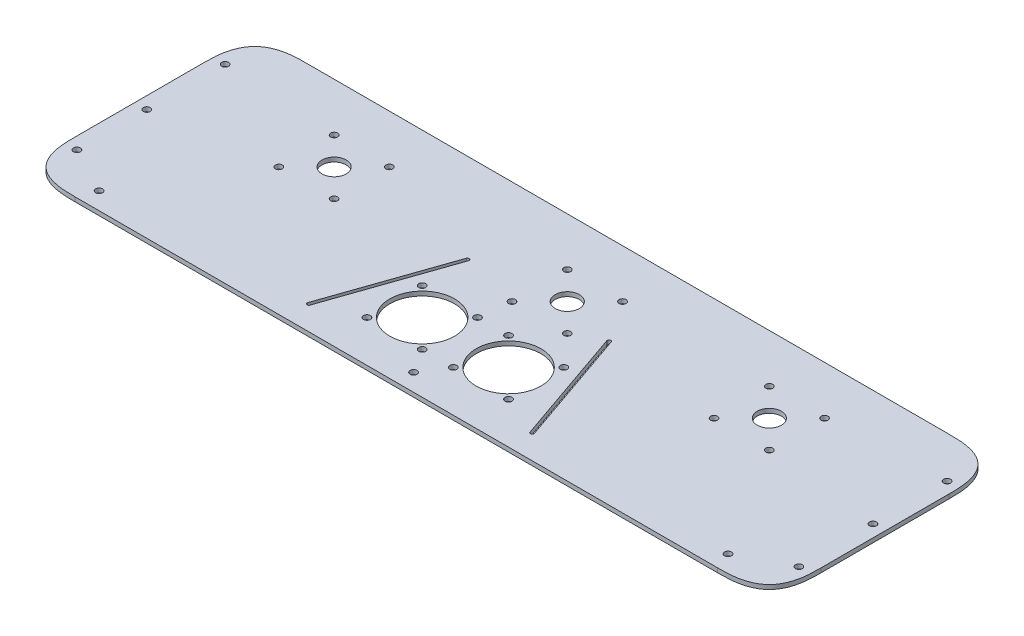
from build123d import *

# Parameters (mm, degrees)
SKETCH1_W           = 432
SKETCH1_H           = 200
BOSS_EXTRUDE1_DEPTH = 2.5
SKETCH3_R           = 7
SKETCH3_R_2         = 2
SKETCH3_W           = 498.20945101
SKETCH3_H           = 57.36356312
CUT_EXTRUDE1_DEPTH  = 2.5
SKETCH5_W           = 366.875294571
SKETCH5_H           = 10
SKETCH5_W_2         = 65.124705429
CUT_EXTRUDE3_DEPTH  = 2.5
SKETCH6_R           = 2
CUT_EXTRUDE4_DEPTH  = 2.5
CUT_EXTRUDE5_DEPTH  = 2.5
FILLET1_SIZE        = 30
SKETCH9_R           = 2
CUT_EXTRUDE6_DEPTH  = 2.5
SKETCH10_R          = 2
CUT_EXTRUDE7_DEPTH  = 2.5
SKETCH6_3_R         = 18.75
CUT_EXTRUDE8_DEPTH  = 10
SKETCH12_R          = 7
SKETCH12_R_2        = 2
CUT_EXTRUDE9_DEPTH  = 10


with BuildPart() as part:
    # Sketch1 → Boss-Extrude1 (new body)
    with BuildSketch(Plane(origin=(0, 0, 0), x_dir=(1, 0, 0), z_dir=(0, 1, 0))):
        with Locations((112.865968756, 71.914913526)):
            Rectangle(SKETCH1_W, SKETCH1_H)
    extrude(amount=BOSS_EXTRUDE1_DEPTH)

    # Sketch3 → Cut-Extrude1 (cut)
    with BuildSketch(Plane(origin=(0, 2.5, 0), x_dir=(1, 0, 0), z_dir=(0, 1, 0))):
        with Locations(Location((-13.134031244, 71.914913526, 0), (0, 0, 270))):
            Circle(SKETCH3_R)
        with Locations(Location((-29.135857702, 55.913087067, 0), (0, 0, 270))):
            Circle(SKETCH3_R_2)
        with Locations(Location((-29.135857702, 87.916739984, 0), (0, 0, 270))):
            Circle(SKETCH3_R_2)
        with Locations(Location((2.867795214, 55.913087067, 0), (0, 0, 270))):
            Circle(SKETCH3_R_2)
        with Locations(Location((2.867795214, 87.916739984, 0), (0, 0, 270))):
            Circle(SKETCH3_R_2)
        with Locations(Location((238.865968756, 71.914913526, 0), (0, 0, 270))):
            Circle(SKETCH3_R)
        with Locations((79.761243251, 144.596695086)):
            Rectangle(SKETCH3_W, SKETCH3_H)
        with Locations(Location((222.864142298, 55.913087067, 0), (0, 0, 270))):
            Circle(SKETCH3_R_2)
        with Locations(Location((254.867795214, 87.916739984, 0), (0, 0, 270))):
            Circle(SKETCH3_R_2)
        with Locations(Location((222.864142298, 87.916739984, 0), (0, 0, 270))):
            Circle(SKETCH3_R_2)
        with Locations(Location((254.867795214, 55.913087067, 0), (0, 0, 270))):
            Circle(SKETCH3_R_2)
    extrude(amount=-CUT_EXTRUDE1_DEPTH, mode=Mode.SUBTRACT)

    # Sketch5 → Cut-Extrude3 (cut)
    with BuildSketch(Plane(origin=(0, 2.5, 0), x_dir=(1, 0, 0), z_dir=(0, 1, 0))):
        with Locations((80.303616041, -23.085086474)):
            Rectangle(SKETCH5_W, SKETCH5_H)
        with Locations((296.303616042, -23.085086474)):
            Rectangle(SKETCH5_W_2, SKETCH5_H)
    extrude(amount=-CUT_EXTRUDE3_DEPTH, mode=Mode.SUBTRACT)

    # Sketch6 → Cut-Extrude4 (cut)
    with BuildSketch(Plane(origin=(0, 2.5, 0), x_dir=(1, 0, 0), z_dir=(0, 1, 0))):
        with Locations(Location((71.864142298, 5.913087067, 0), (0, 0, 270))):
            Circle(SKETCH6_R)
        with Locations(Location((71.864142298, 37.916739984, 0), (0, 0, 270))):
            Circle(SKETCH6_R)
        with Locations(Location((103.867795214, 37.916739984, 0), (0, 0, 270))):
            Circle(SKETCH6_R)
        with Locations(Location((103.867795214, 5.913087067, 0), (0, 0, 270))):
            Circle(SKETCH6_R)
        with Locations(Location((121.864142298, 5.913087067, 0), (0, 0, 270))):
            Circle(SKETCH6_R)
        with Locations(Location((121.864142298, 37.916739984, 0), (0, 0, 270))):
            Circle(SKETCH6_R)
        with Locations(Location((153.867795214, 37.916739984, 0), (0, 0, 270))):
            Circle(SKETCH6_R)
        with Locations(Location((153.867795214, 5.913087067, 0), (0, 0, 270))):
            Circle(SKETCH6_R)
    extrude(amount=-CUT_EXTRUDE4_DEPTH, mode=Mode.SUBTRACT)

    # Sketch8 → Cut-Extrude5 (cut)
    with BuildSketch(Plane(origin=(0, 2.5, 0), x_dir=(1, 0, 0), z_dir=(0, 1, 0))):
        with BuildLine():
            Line((176.582305496, -4.412929011), (152.923062834, 63.765083659))
            ThreePointArc((152.923062834, 63.765083659), (153.539952677, 65.037658577), (154.812527595, 64.420768733))
            Line((154.812527595, 64.420768733), (178.471770257, -3.757243937))
            ThreePointArc((178.471770257, -3.757243937), (177.854880414, -5.029818855), (176.582305496, -4.412929011))
        make_face()
        with BuildLine():
            Line((47.260167255, -3.757243937), (70.919409917, 64.420768733))
            ThreePointArc((70.919409917, 64.420768733), (72.191984835, 65.037658577), (72.808874679, 63.765083659))
            Line((72.808874679, 63.765083659), (49.149632016, -4.412929011))
            ThreePointArc((49.149632016, -4.412929011), (47.877057099, -5.029818855), (47.260167255, -3.757243937))
        make_face()
    extrude(amount=-CUT_EXTRUDE5_DEPTH, mode=Mode.SUBTRACT)

    # Fillet1
    # a fillet whose section is not a circle: 30 mm, written as the material it takes off along each edge
    with BuildSketch(Plane(origin=(-103.134031244, -75, -115.914913526), x_dir=(0, 0, 1), z_dir=(0, 1, 0)), Plane(origin=(-103.134031244, 77.5, 18.085086474), x_dir=(0, 0, -1), z_dir=(0, -1, 0)), Plane(origin=(328.865968756, 77.5, 18.085086474), x_dir=(-1, 0, 0), z_dir=(0, -1, 0))) as fillet1_piece_1:
        with BuildLine():
            add(Edge.make_bspline([(FILLET1_SIZE, 0), (FILLET1_SIZE * 0.831801948466, 0), (FILLET1_SIZE * 0.663603896932, 0), (FILLET1_SIZE * 0.292893218813, FILLET1_SIZE * 0.0716919198361), (FILLET1_SIZE * 0.0716919198361, FILLET1_SIZE * 0.292893218813), (0, FILLET1_SIZE * 0.663603896932), (0, FILLET1_SIZE * 0.831801948466), (0, FILLET1_SIZE)], knots=[0, 0, 0, 0, 0, 0, 0.5, 0.5, 1, 1, 1, 1, 1, 1], degree=5))
            Line((0, FILLET1_SIZE), (0, 0))
            Line((0, 0), (FILLET1_SIZE, 0))
        make_face()
    extrude(amount=152.5, mode=Mode.SUBTRACT)
    with BuildSketch(Plane(origin=(328.865968756, 77.5, -115.914913526), x_dir=(-1, 0, 0), z_dir=(0, -1, 0))) as fillet1_piece_2:
        with BuildLine():
            add(Edge.make_bspline([(FILLET1_SIZE, 0), (FILLET1_SIZE * 0.831801948466, 0), (FILLET1_SIZE * 0.663603896932, 0), (FILLET1_SIZE * 0.292893218813, -FILLET1_SIZE * 0.0716919198361), (FILLET1_SIZE * 0.0716919198361, -FILLET1_SIZE * 0.292893218813), (0, -FILLET1_SIZE * 0.663603896932), (0, -FILLET1_SIZE * 0.831801948466), (0, -FILLET1_SIZE)], knots=[0, 0, 0, 0, 0, 0, 0.5, 0.5, 1, 1, 1, 1, 1, 1], degree=5))
            Line((0, -FILLET1_SIZE), (0, 0))
            Line((0, 0), (FILLET1_SIZE, 0))
        make_face()
    extrude(amount=152.5, mode=Mode.SUBTRACT)

    # Sketch9 → Cut-Extrude6 (cut)
    with BuildSketch(Plane(origin=(0, 2.5, 0), x_dir=(1, 0, 0), z_dir=(0, 1, 0))):
        with Locations(Location((321.865968752, 6.010283068, 0), (0, 0, 270))):
            Circle(SKETCH9_R)
        with Locations(Location((321.865968752, 48.914945481, 0), (0, 0, 270))):
            Circle(SKETCH9_R)
        with Locations(Location((321.865968752, 91.819607898, 0), (0, 0, 270))):
            Circle(SKETCH9_R)
        with Locations(Location((-96.134031244, 46.467317494, 0), (0, 0, 270))):
            Circle(SKETCH9_R)
        with Locations(Location((-96.134031244, 91.819607898, 0), (0, 0, 270))):
            Circle(SKETCH9_R)
        with Locations(Location((-96.134031244, 6.010283068, 0), (0, 0, 270))):
            Circle(SKETCH9_R)
    extrude(amount=-CUT_EXTRUDE6_DEPTH, mode=Mode.SUBTRACT)

    # Sketch10 → Cut-Extrude7 (cut)
    with BuildSketch(Plane(origin=(0, 2.5, 0), x_dir=(1, 0, 0), z_dir=(0, 1, 0))):
        with Locations(Location((112.866022655, -8.085086472, 0), (0, 0, 270))):
            Circle(SKETCH10_R)
        with Locations(Location((294.941757967, -8.085086472, 0), (0, 0, 270))):
            Circle(SKETCH10_R)
        with Locations(Location((-69.209712656, -8.085086472, 0), (0, 0, 270))):
            Circle(SKETCH10_R)
    extrude(amount=-CUT_EXTRUDE7_DEPTH, mode=Mode.SUBTRACT)

    # Sketch6<3> → Cut-Extrude8 (cut)
    with BuildSketch(Plane(origin=(0, 2.5, 0), x_dir=(1, 0, 0), z_dir=(0, 1, 0))):
        with Locations(Location((137.865968756, 21.914913526, 0), (0, 0, 270))):
            Circle(SKETCH6_3_R)
        with Locations(Location((87.865968756, 21.914913526, 0), (0, 0, 270))):
            Circle(SKETCH6_3_R)
    extrude(amount=-CUT_EXTRUDE8_DEPTH, mode=Mode.SUBTRACT)

    # Sketch12 → Cut-Extrude9 (cut)
    with BuildSketch(Plane(origin=(0, 2.5, 0), x_dir=(1, 0, 0), z_dir=(0, 1, 0))):
        with Locations(Location((121.864142298, 71.914913526, 0), (0, 0, 270))):
            Circle(SKETCH12_R)
        with Locations(Location((105.86231584, 55.913087067, 0), (0, 0, 270))):
            Circle(SKETCH12_R_2)
        with Locations(Location((105.86231584, 87.916739984, 0), (0, 0, 270))):
            Circle(SKETCH12_R_2)
        with Locations(Location((137.865968756, 87.916739984, 0), (0, 0, 270))):
            Circle(SKETCH12_R_2)
        with Locations(Location((137.865968756, 55.913087067, 0), (0, 0, 270))):
            Circle(SKETCH12_R_2)
    extrude(amount=-CUT_EXTRUDE9_DEPTH, mode=Mode.SUBTRACT)


solid = part.part
